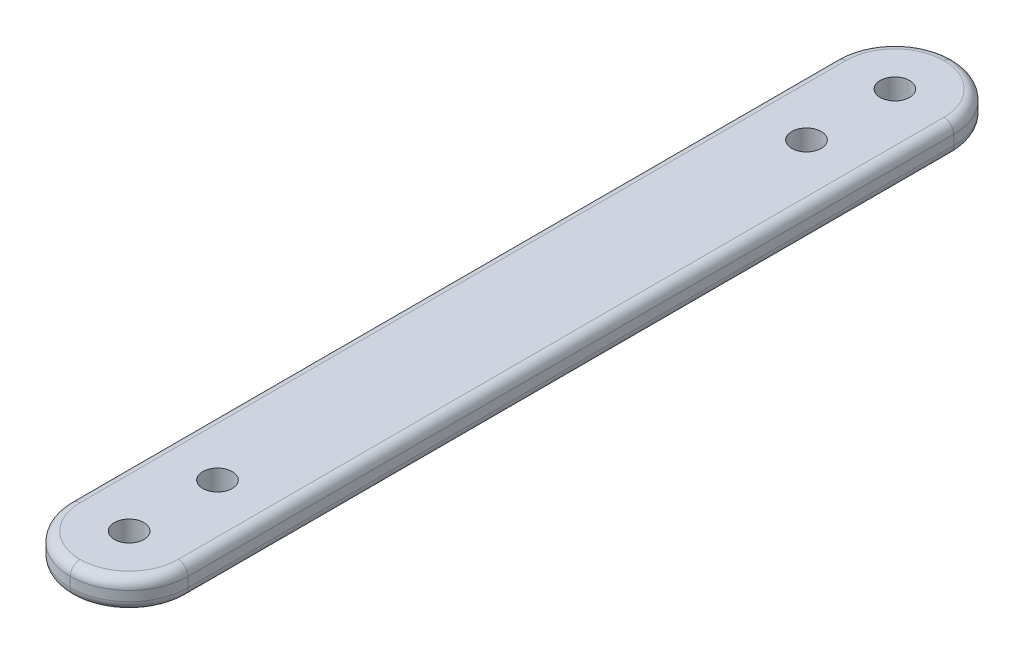
from build123d import *

# Parameters (mm, degrees)
SKETCH1_W           = 25.4
SKETCH1_H           = 190.5
SKETCH1_R           = 3.175
BOSS_EXTRUDE1_DEPTH = 6.35
FILLET2_R           = 12.7
FILLET3_R           = 2.116666667


with BuildPart() as part:
    # Sketch1 → Boss-Extrude1 (new body)
    with BuildSketch(Plane(origin=(0, 0, 0), x_dir=(1, 0, 0), z_dir=(0, 1, 0))):
        Rectangle(SKETCH1_W, SKETCH1_H)
        with Locations(Location((0, -82.55, 0), (0, 0, 270))):
            Circle(SKETCH1_R, mode=Mode.SUBTRACT)
        with Locations(Location((0, 63.5, 0), (0, 0, 270))):
            Circle(SKETCH1_R, mode=Mode.SUBTRACT)
        with Locations(Location((0, 82.55, 0), (0, 0, 270))):
            Circle(SKETCH1_R, mode=Mode.SUBTRACT)
        with Locations(Location((0, -63.5, 0), (0, 0, 270))):
            Circle(SKETCH1_R, mode=Mode.SUBTRACT)
    extrude(amount=BOSS_EXTRUDE1_DEPTH)

    # Fillet2
    fillet2_edges = [part.edges().sort_by_distance(p)[0] for p in [
        (-12.7, 3.175, -95.25),
        (12.7, 3.175, -95.25),
        (-12.7, 3.175, 95.25),
        (12.7, 3.175, 95.25),
    ]]
    fillet(fillet2_edges, radius=FILLET2_R - 0.0001)  # a hair under: the kernel refuses the full size

    # Fillet3
    fillet3_edges = [part.edges().sort_by_distance(p)[0] for p in [
        (-12.7, 0, 0),
        (-12.7, 6.35, 0),
        (12.7, 0, 0),
        (8.98028541, 0, 91.53028541),
        (-8.98028541, 0, 91.53028541),
        (8.98028541, 0, -91.53028541),
        (-8.98028541, 0, -91.53028541),
        (12.7, 6.35, 0),
        (8.98028541, 6.35, 91.53028541),
        (-8.98028541, 6.35, 91.53028541),
        (8.98028541, 6.35, -91.53028541),
        (-8.98028541, 6.35, -91.53028541),
    ]]
    fillet(fillet3_edges, radius=FILLET3_R)


solid = part.part
